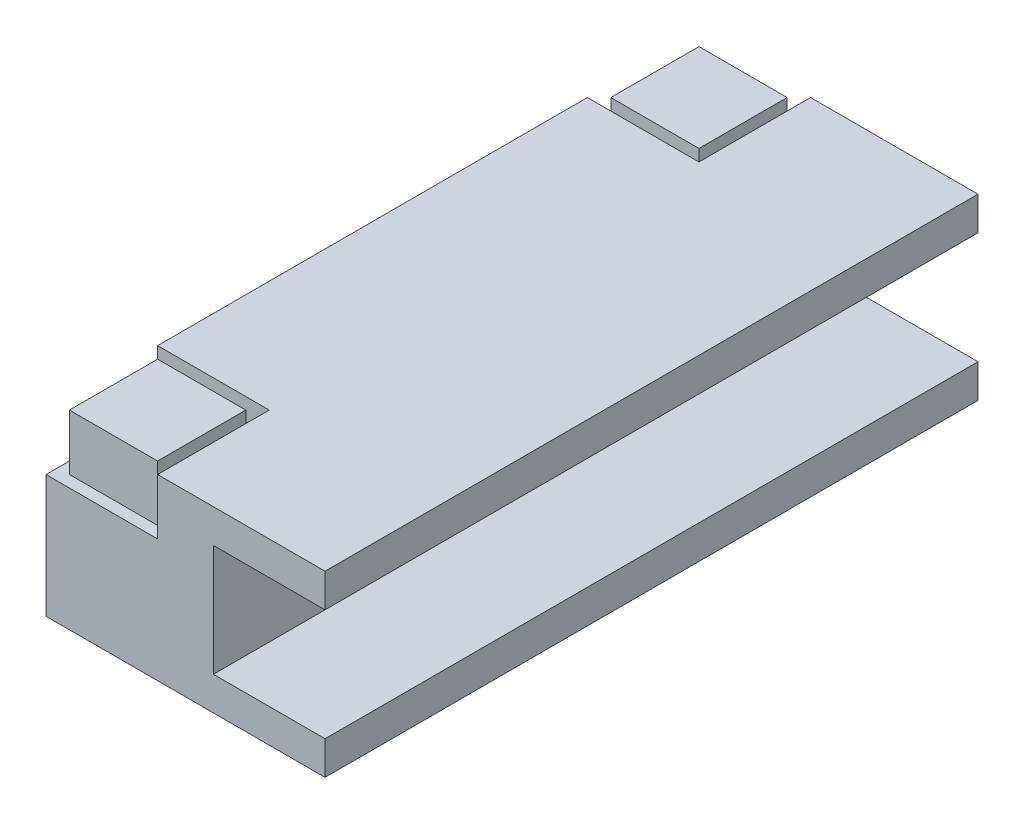
from build123d import *

# Parameters (mm, degrees)
DODANIE_WYCI_GNI_CIE1_DEPTH = 117
SZKIC2_W                    = 20
SZKIC2_H                    = 20
WYTNIJ_WYCI_GNI_CIE1_DEPTH  = 10
SZKIC3_W                    = 15.8
SZKIC3_H                    = 15.8
DODANIE_WYCI_GNI_CIE2_DEPTH = 10
SZKIC4_W                    = 10.4
SZKIC4_H                    = 10.4
WYTNIJ_WYCI_GNI_CIE2_DEPTH  = 15


with BuildPart() as part:
    # Szkic1 → Dodanie-wyciągnięcie1 (new body)
    with BuildSketch(Plane.XY):
        Polygon((10, -16), (10, -10), (-10, -10), (-10, 10), (10, 10), (10, 16), (-40, 16), (-40, -16), align=None)
    extrude(amount=DODANIE_WYCI_GNI_CIE1_DEPTH)

    # Szkic2 → Wytnij-wyciągnięcie1 (cut)
    with BuildSketch(Plane(origin=(0, 16, 0), x_dir=(1, 0, 0), z_dir=(0, 1, 0))):
        with Locations((-30, -107)):
            Rectangle(SZKIC2_W, SZKIC2_H)
        with Locations((-30, -10)):
            Rectangle(SZKIC2_W, SZKIC2_H)
    extrude(amount=-WYTNIJ_WYCI_GNI_CIE1_DEPTH, mode=Mode.SUBTRACT)

    # Szkic3 → Dodanie-wyciągnięcie2 (add)
    with BuildSketch(Plane(origin=(0, 6, 0), x_dir=(1, 0, 0), z_dir=(0, 1, 0))):
        with Locations((-30, -10)):
            Rectangle(SZKIC3_W, SZKIC3_H)
        with Locations((-30, -107)):
            Rectangle(SZKIC3_W, SZKIC3_H)
    extrude(amount=DODANIE_WYCI_GNI_CIE2_DEPTH)

    # Szkic4 → Wytnij-wyciągnięcie2 (cut)
    with BuildSketch(Plane.XZ.offset(16)):
        with Locations((-24.8, 58.5)):
            Rectangle(SZKIC4_W, SZKIC4_H)
    extrude(amount=-WYTNIJ_WYCI_GNI_CIE2_DEPTH, mode=Mode.SUBTRACT)


solid = part.part
